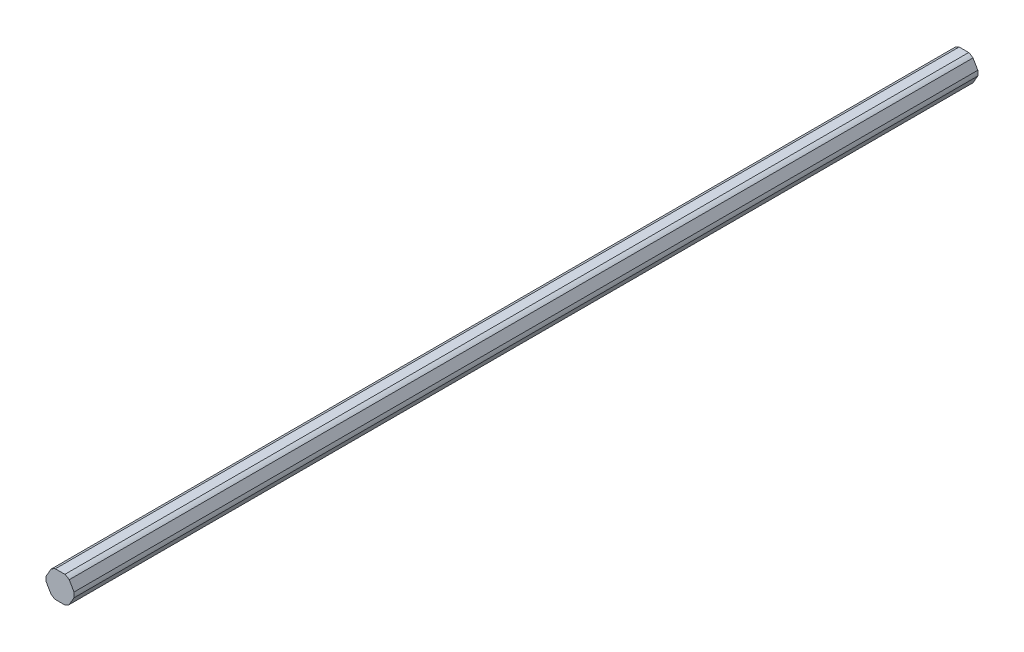
from build123d import *

# Parameters (mm, degrees)
BOSS_EXTRUDE1_DEPTH = 431.8


with BuildPart() as part:
    # Sketch1 → Boss-Extrude1 (new body)
    with BuildSketch(Plane.XY):
        with BuildLine():
            ThreePointArc((-6.643813628, 1.19257724), (-6.75, 0), (-6.643813628, -1.19257724))
            Line((-6.643813628, -1.19257724), (-4.354709, -5.15742276))
            ThreePointArc((-4.354709, -5.15742276), (-3.375, -5.845671476), (-2.289104628, -6.35))
            Line((-2.289104628, -6.35), (2.289104628, -6.35))
            ThreePointArc((2.289104628, -6.35), (3.375, -5.845671476), (4.354709, -5.15742276))
            Line((4.354709, -5.15742276), (6.643813628, -1.19257724))
            ThreePointArc((6.643813628, -1.19257724), (6.723400999, -0.598647646), (6.75, 0))
            ThreePointArc((6.75, 0), (6.723400999, 0.598647646), (6.643813628, 1.19257724))
            Line((6.643813628, 1.19257724), (4.354709, 5.15742276))
            ThreePointArc((4.354709, 5.15742276), (3.375, 5.845671476), (2.289104628, 6.35))
            Line((2.289104628, 6.35), (-2.289104628, 6.35))
            ThreePointArc((-2.289104628, 6.35), (-3.375, 5.845671476), (-4.354709, 5.15742276))
            Line((-4.354709, 5.15742276), (-6.643813628, 1.19257724))
        make_face()
    extrude(amount=BOSS_EXTRUDE1_DEPTH)


solid = part.part
